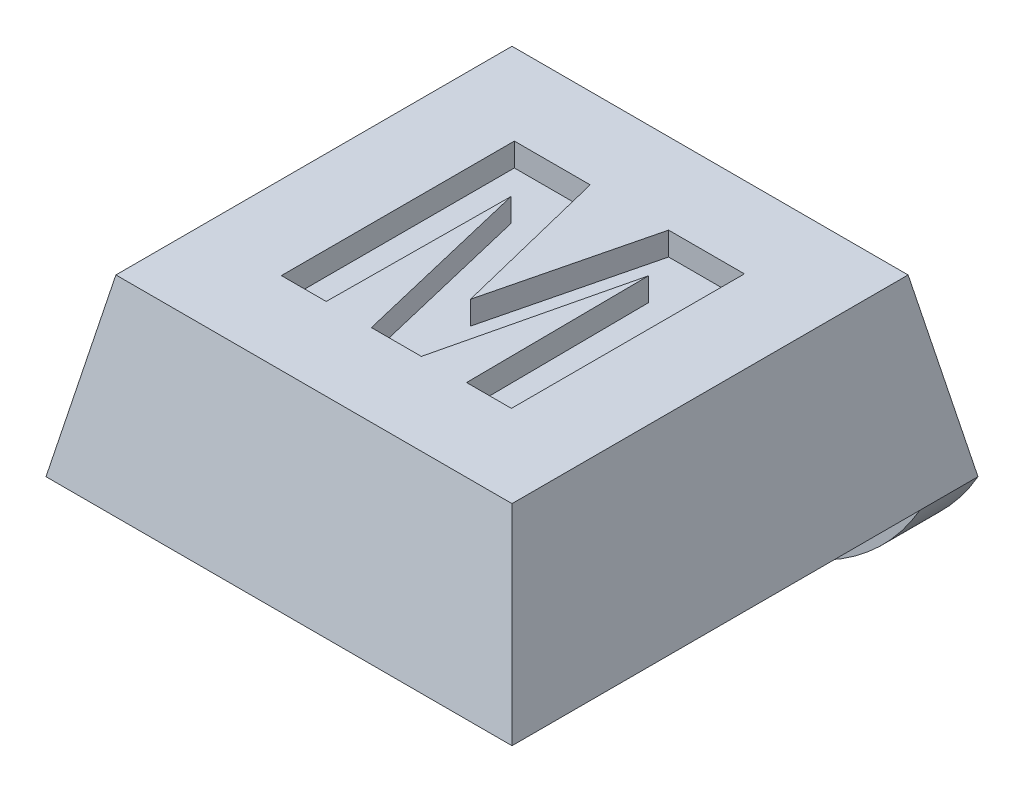
from build123d import *

# Parameters (mm, degrees)
SKETCH1_W               = 8
SKETCH1_H               = 8
BOSS_EXTRUDE1_DEPTH     = 3
CUT_EXTRUDE1_DEPTH      = 12.704699911
CUT_EXTRUDE1_DEPTH_BACK = 12.704699911
CUT_EXTRUDE2_DEPTH      = 11
SKETCH4_R               = 1.75
CUT_EXTRUDE3_DEPTH      = 0.4
SKETCH5_W               = 8
SKETCH5_H               = 1
BOSS_EXTRUDE2_DEPTH     = 2
FILLET1_R               = 4
CUT_EXTRUDE4_DEPTH      = 0.4


with BuildPart() as part:
    # Sketch1 → Boss-Extrude1 (new body)
    with BuildSketch(Plane(origin=(0, 0, 0), x_dir=(1, 0, 0), z_dir=(0, 1, 0))):
        with Locations((4, 4)):
            Rectangle(SKETCH1_W, SKETCH1_H)
    extrude(amount=BOSS_EXTRUDE1_DEPTH)

    # Sketch2 → Cut-Extrude1 (cut, two sides: drawn at the far end of the back side and taken through both)
    with BuildSketch(Plane.XY.offset(-CUT_EXTRUDE1_DEPTH_BACK)):
        Polygon((0, 0), (0.6, 3), (0, 3), align=None)
        Polygon((8, 0), (7.4, 3), (8, 3), align=None)
    extrude(amount=CUT_EXTRUDE1_DEPTH + CUT_EXTRUDE1_DEPTH_BACK, mode=Mode.SUBTRACT)

    # Sketch3 → Cut-Extrude2 (cut)
    with BuildSketch(Plane(origin=(0, 0, 0), x_dir=(0, 0, -1), z_dir=(1, 0, 0))):
        Polygon((0, 0), (0.6, 3), (0, 3), align=None)
        Polygon((8, 3), (7.4, 3), (8, 0), align=None)
    extrude(amount=CUT_EXTRUDE2_DEPTH, mode=Mode.SUBTRACT)

    # Sketch4 → Cut-Extrude3 (cut)
    with BuildSketch(Plane.XZ):
        with Locations(Location((4, -3.75, 0), (0, 0, 270))):
            Circle(SKETCH4_R)
    extrude(amount=-CUT_EXTRUDE3_DEPTH, mode=Mode.SUBTRACT)

    # Sketch5 → Boss-Extrude2 (add)
    with BuildSketch(Plane.XZ):
        with Locations((4, -7.5)):
            Rectangle(SKETCH5_W, SKETCH5_H)
    extrude(amount=BOSS_EXTRUDE2_DEPTH)

    # Fillet1
    # the kernel refuses this fillet: 4 mm, written as the material it takes off along each edge
    with BuildSketch(Plane(origin=(8, -2, -16.660254038), x_dir=(0, 1, 0), z_dir=(0, 0, 1)), Plane(origin=(0, -2, 1.660254038), x_dir=(0, 1, 0), z_dir=(0, 0, -1))) as fillet1_piece_1:
        with BuildLine():
            CenterArc((4, 3.464101615), FILLET1_R, 180, 60)
            Line((0, 3.464101615), (-0.08, 3.464101615))
            Line((-0.08, 3.464101615), (-0.08, 0))
            Line((-0.08, 0), (0, -0.08))
            ThreePointArc((0, -0.08), (1, -0.08), (1.96, -0.069282032))
            Line((1.96, -0.069282032), (2, 0))
        make_face()
    extrude(amount=18.320508076, mode=Mode.SUBTRACT)

    # Sketch6 → Cut-Extrude4 (cut)
    with BuildSketch(Plane(origin=(0, 3, 0), x_dir=(1, 0, 0), z_dir=(0, 1, 0))):
        Polygon((2.030290665, 2.010567225), (2.030290665, 6.010567225), (3.331572716, 6.010567225), (4.004649639, 3.28220184), (4.677726562, 6.010567225), (5.979008613, 6.010567225), (5.979008613, 2.010567225), (5.209777844, 2.010567225), (5.184136818, 5.159605686), (4.433335536, 2.010567225), (3.575963742, 2.010567225), (2.82516246, 5.159605686), (2.799521434, 2.010567225), align=None)
    extrude(amount=-CUT_EXTRUDE4_DEPTH, mode=Mode.SUBTRACT)


solid = part.part
